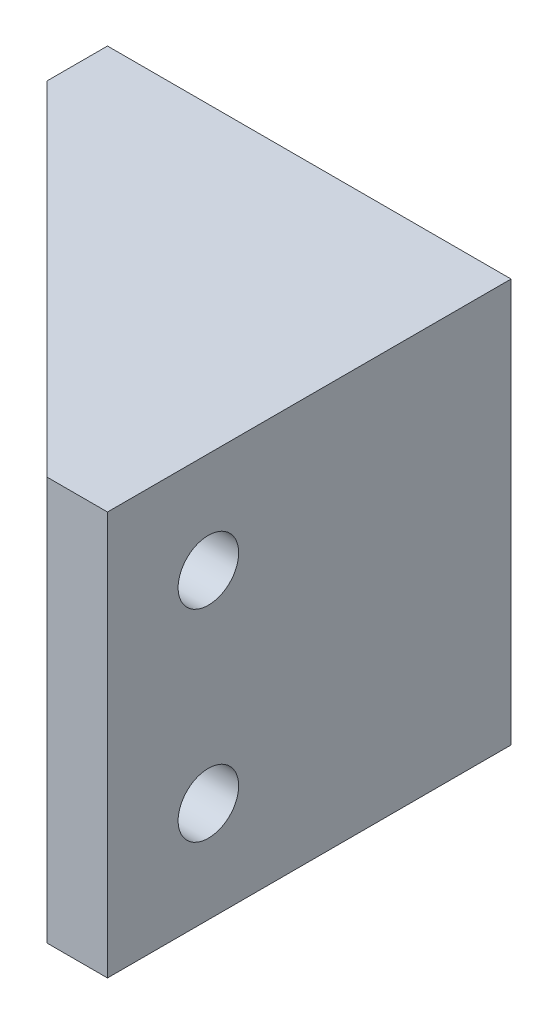
from build123d import *

# Parameters (mm, degrees)
SKETCH_1_W                         = 40
SKETCH_1_H                         = 40
EXTRUDE_1_DEPTH                    = 6
SKETCH_2_R                         = 3
CUT_EXTRUDE_1_DEPTH                = 6
PATTERN_LINEAR_1_COUNT             = 2
PATTERN_LINEAR_1_PITCH             = 20
CHAMFER_1_SIZE                     = 6
SKETCH_3_W                         = 34
SKETCH_3_H                         = 3
EXTRUDE_2_DEPTH                    = 34
CHAMFER_2_SIZE                     = 34
PATTERN_LINEAR_2_COUNT             = 2
PATTERN_LINEAR_2_PITCH             = 37
CHAMFER_2_OF_PATTERN_LINEAR_2_SIZE = 34
SHELL_START                        = 2.8
SHELL_3_OUTLINE_W                  = 3.2
SHELL_3_OUTLINE_H                  = 34.4
SHELL_3_DEPTH                      = 34.4
SHELL_3_2_OUTLINE_W                = 31.2
SHELL_3_2_OUTLINE_H                = 34.4
SHELL_3_2_OUTLINE_R                = 5.8
SHELL_3_2_DEPTH                    = 3.2
SHELL_START_2                      = -8.776349614
SHELL_3_3_OUTLINE_R                = 5.8
SHELL_3_3_OUTLINE_R_2              = 3
SHELL_3_3_DEPTH                    = 3.2
SHELL_START_3                      = -16
SHELL_3_4_DEPTH                    = 37
CHAMFER_5_SIZE                     = 5.67128182
CHAMFER_5_SIZE_2                   = 1
CHAMFER_6_SIZE                     = 5.67128182
CHAMFER_6_SIZE_2                   = 1
CHAMFER_7_SIZE                     = 2.7
CHAMFER_7_SIZE_2                   = 4.67653718


with BuildPart() as part:
    # Эскиз1 → Бобышка-Вытянуть1 (new body)
    with BuildSketch(Plane.XY):
        with Locations((-22.776349614, 2.36503856)):
            Rectangle(SKETCH_1_W, SKETCH_1_H)
    extrude(amount=EXTRUDE_1_DEPTH)

    # Эскиз2 → Вырез-Вытянуть1 (cut)
    with BuildSketch(Plane.XY.offset(6)):
        with Locations((-32.776349614, 12.36503856)):
            Circle(SKETCH_2_R)
    cut_extrude_1 = extrude(amount=-CUT_EXTRUDE_1_DEPTH, mode=Mode.SUBTRACT)

    # Линейный массив1: Вырез-Вытянуть1 ×2
    with Locations(*[(0, -i * PATTERN_LINEAR_1_PITCH, 0) for i in range(1, PATTERN_LINEAR_1_COUNT)]):
        add(cut_extrude_1, mode=Mode.SUBTRACT)

    # Фаска1
    chamfer_1_edges = [part.edges().sort_by_distance(p)[0] for p in [
        (-2.776349614, 2.36503856, 6),
    ]]
    chamfer(chamfer_1_edges, length=CHAMFER_1_SIZE - 0.0001)  # a hair under: the kernel refuses the full size

    # Зеркальное отражение1: part across plane


with BuildPart() as part_1:
    add(part.part)
    add(part.part.mirror(Plane(origin=(-8.776349614, 0, 6), x_dir=(-0.7071067811865465, 0, 0.7071067811865486), z_dir=(0.7071067811865488, 0, 0.7071067811865464))))

    # Эскиз3 → Бобышка-Вытянуть2 (add)
    with BuildSketch(Plane.XY.offset(6)):
        with Locations((-25.776349614, 20.86503856)):
            Rectangle(SKETCH_3_W, SKETCH_3_H)
    extrude_2 = extrude(amount=EXTRUDE_2_DEPTH)

    # Фаска2
    chamfer_2_edges = [part_1.edges().sort_by_distance(p)[0] for p in [
        (-42.776349614, 20.86503856, 40),
    ]]
    chamfer(chamfer_2_edges, length=CHAMFER_2_SIZE)

    # Линейный массив2: Бобышка-Вытянуть2 ×2
    with Locations(*[(0, -i * PATTERN_LINEAR_2_PITCH, 0) for i in range(1, PATTERN_LINEAR_2_COUNT)]):
        add(extrude_2)

    # Фаска2 of Линейный массив2
    chamfer_2_of_pattern_linear_2_edges = [part_1.edges().sort_by_distance(p)[0] for p in [
        (-42.776349614, -16.13496144, 40),
    ]]
    chamfer(chamfer_2_of_pattern_linear_2_edges, length=CHAMFER_2_OF_PATTERN_LINEAR_2_SIZE)

    # Оболочка3: read off the stored shape, not the designer's step
    # Оболочка3 outline → Оболочка3 (cut)
    with BuildSketch(Plane.XY.offset(SHELL_START)):
        with Locations((-7.176349614, 2.36503856)):
            Rectangle(SHELL_3_OUTLINE_W, SHELL_3_OUTLINE_H)
    extrude(amount=SHELL_3_DEPTH, mode=Mode.SUBTRACT)

    # Shell 3 2 outline → Shell 3 2 (cut)
    with BuildSketch(Plane.XY.offset(SHELL_START)):
        with Locations((-24.376349614, 2.36503856)):
            Rectangle(SHELL_3_2_OUTLINE_W, SHELL_3_2_OUTLINE_H)
        with Locations((-32.776349614, -7.63496144)):
            Circle(SHELL_3_2_OUTLINE_R, mode=Mode.SUBTRACT)
        with Locations((-32.776349614, 12.36503856)):
            Circle(SHELL_3_2_OUTLINE_R, mode=Mode.SUBTRACT)
    extrude(amount=SHELL_3_2_DEPTH, mode=Mode.SUBTRACT)

    # Shell 3 3 outline → Shell 3 3 (add)
    # profile 1 of 2: a face of its own
    with BuildSketch(Plane.YZ.offset(SHELL_START_2)):
        with Locations((12.36503856, 30)):
            Circle(SHELL_3_3_OUTLINE_R)
        with Locations((12.36503856, 30)):
            Circle(SHELL_3_3_OUTLINE_R_2, mode=Mode.SUBTRACT)
    # profile 2 of 2: a face of its own
    with BuildSketch(Plane.YZ.offset(SHELL_START_2)):
        with Locations((-7.63496144, 30)):
            Circle(SHELL_3_3_OUTLINE_R)
        with Locations((-7.63496144, 30)):
            Circle(SHELL_3_3_OUTLINE_R_2, mode=Mode.SUBTRACT)
    extrude(amount=SHELL_3_3_DEPTH)

    # Shell 3 4 outline → Shell 3 4 (add)
    with BuildSketch(Plane(origin=(0, 0, 0), x_dir=(1, 0, 0), z_dir=(0, 1, 0)).offset(SHELL_START_3)):
        Polygon((-39.976349614, -4.840202025), (-39.976349614, -6), (-38.81655164, -6), align=None)
        Polygon((-7.61655164, -37.2), (-8.776349614, -36.040202025), (-8.776349614, -37.2), align=None)
    extrude(amount=SHELL_3_4_DEPTH)

    # Фаска5
    # the kernel refuses this chamfer: 5.67128182, 1 mm, written as the material it takes off along each edge
    with BuildSketch(Plane(origin=(-8.776349614, 12.36503856, 30), x_dir=(0, 1, 0), z_dir=(0, 0, -1))) as chamfer_5_piece_1_section:
        Polygon((5.8, CHAMFER_5_SIZE), (5.8 - CHAMFER_5_SIZE_2, 0), (5.8, 0), align=None)
    chamfer_5_piece_1 = revolve(axis=Axis((-8.776349614, 12.36503856, 30), (1, 0, 0)), mode=Mode.PRIVATE)
    chamfer_5_piece_1 = split(chamfer_5_piece_1, bisect_by=Plane(origin=(-5.576349614, 12.36503856, 30), z_dir=(-1, 0, 0)), keep=Keep.TOP, mode=Mode.PRIVATE)
    add(chamfer_5_piece_1, mode=Mode.SUBTRACT)
    with BuildSketch(Plane(origin=(-8.776349614, -7.63496144, 30), x_dir=(0, 1, 0), z_dir=(0, 0, -1))) as chamfer_5_piece_2_section:
        Polygon((5.8 - CHAMFER_5_SIZE_2, 0), (5.8, CHAMFER_5_SIZE), (5.8, 0), align=None)
    chamfer_5_piece_2 = revolve(axis=Axis((-8.776349614, -7.63496144, 30), (1, 0, 0)), mode=Mode.PRIVATE)
    chamfer_5_piece_2 = split(chamfer_5_piece_2, bisect_by=Plane(origin=(-5.576349614, -7.63496144, 30), z_dir=(-1, 0, 0)), keep=Keep.TOP, mode=Mode.PRIVATE)
    add(chamfer_5_piece_2, mode=Mode.SUBTRACT)

    # Фаска6
    # the kernel refuses this chamfer: 5.67128182, 1 mm, written as the material it takes off along each edge
    with BuildSketch(Plane(origin=(-32.776349614, -7.63496144, 6), x_dir=(1, 0, 0), z_dir=(0, -1, 0))) as chamfer_6_piece_1_section:
        Polygon((5.8, -CHAMFER_6_SIZE), (5.8 - CHAMFER_6_SIZE_2, 0), (5.8, 0), align=None)
    chamfer_6_piece_1 = revolve(axis=Axis((-32.776349614, -7.63496144, 6), (0, 0, 1)), mode=Mode.PRIVATE)
    chamfer_6_piece_1 = split(chamfer_6_piece_1, bisect_by=Plane(origin=(-32.776349614, -7.63496144, 2.8), z_dir=(0, 0, 1)), keep=Keep.TOP, mode=Mode.PRIVATE)
    add(chamfer_6_piece_1, mode=Mode.SUBTRACT)
    with BuildSketch(Plane(origin=(-32.776349614, 12.36503856, 6), x_dir=(1, 0, 0), z_dir=(0, -1, 0))) as chamfer_6_piece_2_section:
        Polygon((5.8, -CHAMFER_6_SIZE), (5.8 - CHAMFER_6_SIZE_2, 0), (5.8, 0), align=None)
    chamfer_6_piece_2 = revolve(axis=Axis((-32.776349614, 12.36503856, 6), (0, 0, 1)), mode=Mode.PRIVATE)
    chamfer_6_piece_2 = split(chamfer_6_piece_2, bisect_by=Plane(origin=(-32.776349614, 12.36503856, 2.8), z_dir=(0, 0, 1)), keep=Keep.TOP, mode=Mode.PRIVATE)
    add(chamfer_6_piece_2, mode=Mode.SUBTRACT)

    # Фаска7
    # the kernel refuses this chamfer: 4.67653718, 2.7 mm, written as the material it adds along each edge
    with BuildSketch(Plane(origin=(-39.976349614, 19.56503856, 2.8), x_dir=(0, 0, 1), z_dir=(0, -1, 0))) as chamfer_7_piece_1_section:
        Polygon((CHAMFER_7_SIZE, 0), (0, -CHAMFER_7_SIZE_2), (0, 0), align=None)
    chamfer_7_piece_1 = extrude(amount=34.4, mode=Mode.PRIVATE)
    chamfer_7_piece_1 = chamfer_7_piece_1 - Plane(origin=(-32.776349614, -7.63496144, 2.8), x_dir=(1, 0, 0), z_dir=(0, 0, 1)) * Cylinder(3, 88, mode=Mode.PRIVATE)
    chamfer_7_piece_1 = chamfer_7_piece_1 - Plane(origin=(-32.776349614, 12.36503856, 2.8), x_dir=(1, 0, 0), z_dir=(0, 0, 1)) * Cylinder(3, 88, mode=Mode.PRIVATE)
    add(chamfer_7_piece_1)
    with BuildSketch(Plane(origin=(-5.576349614, -14.83496144, 37.2), x_dir=(-1, 0, 0), z_dir=(0, 1, 0))) as chamfer_7_piece_2_section:
        Polygon((CHAMFER_7_SIZE, 0), (0, -CHAMFER_7_SIZE_2), (0, 0), align=None)
    chamfer_7_piece_2 = extrude(amount=34.4, mode=Mode.PRIVATE)
    chamfer_7_piece_2 = chamfer_7_piece_2 - Plane(origin=(-5.576349614, -7.63496144, 30), x_dir=(0, 0, -1), z_dir=(-1, 0, 0)) * Cylinder(3, 88, mode=Mode.PRIVATE)
    chamfer_7_piece_2 = chamfer_7_piece_2 - Plane(origin=(-5.576349614, 12.36503856, 30), x_dir=(0, 0, -1), z_dir=(-1, 0, 0)) * Cylinder(3, 88, mode=Mode.PRIVATE)
    add(chamfer_7_piece_2)


solid = part_1.part
